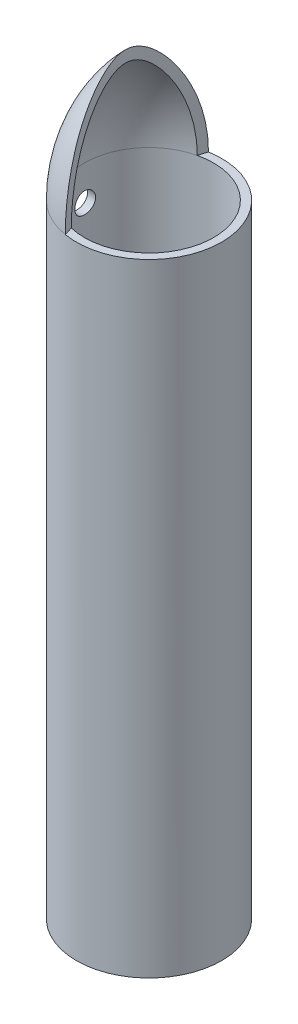
from build123d import *

# Parameters (mm, degrees)
SKETCH1_R           = 10.5
SKETCH1_R_2         = 9.35
BOSS_EXTRUDE1_DEPTH = 45
SKETCH3_R           = 33.16
CUT_EXTRUDE1_DEPTH  = 92.216774796
SKETCH4_R           = 1.5
CUT_EXTRUDE2_DEPTH  = 64.90355811


with BuildPart() as part:
    # Sketch1 → Boss-Extrude1 (new, symmetric)
    with BuildSketch(Plane(origin=(0, 0, 0), x_dir=(1, 0, 0), z_dir=(0, 1, 0))):
        Circle(SKETCH1_R)
        Circle(SKETCH1_R_2, mode=Mode.SUBTRACT)
    extrude(amount=BOSS_EXTRUDE1_DEPTH, both=True)

    # Sketch2 → Revolve1 (revolve)
    with BuildSketch(Plane.XY):
        with BuildLine():
            Line((10.5, 45), (9.35, 45))
            ThreePointArc((9.35, 45), (6.880803245, 55.402649617), (0, 63.585961804))
            Line((0, 63.585961804), (0, 65))
            ThreePointArc((0, 65), (7.715441901, 56.294356998), (10.5, 45))
        make_face()
    revolve(axis=Axis((0, 65, 0), (0, -1, 0)))

    # Sketch3 → Cut-Extrude1 (cut, through all)
    with BuildSketch(Plane(origin=(0, 45, 0), x_dir=(1, 0, 0), z_dir=(0, 1, 0))):
        with Locations((29.75, 0)):
            Circle(SKETCH3_R)
    extrude(amount=CUT_EXTRUDE1_DEPTH, mode=Mode.SUBTRACT)

    # Sketch4 → Cut-Extrude2 (cut, through all)
    with BuildSketch(Plane(origin=(0, 0, 0), x_dir=(0, 0, -1), z_dir=(1, 0, 0))):
        with Locations((0, 40)):
            Circle(SKETCH4_R)
    extrude(amount=-CUT_EXTRUDE2_DEPTH, mode=Mode.SUBTRACT)


solid = part.part
